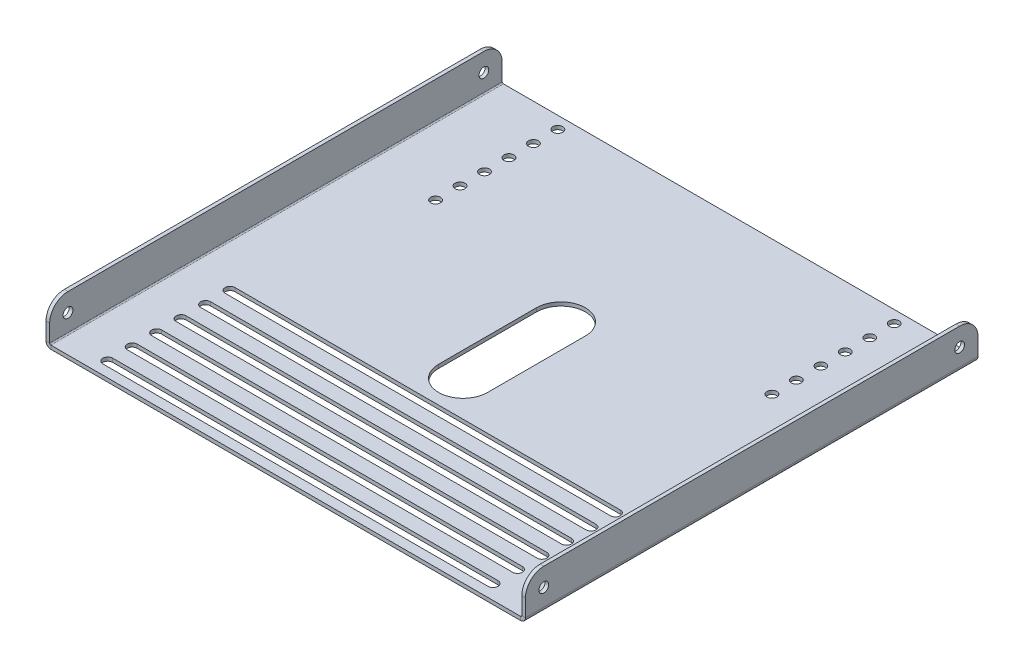
from build123d import *

# Parameters (mm, degrees)
SKETCH1_W                      = 392
SKETCH1_H                      = 370
BASE_FLANGE1_DEPTH             = 3
EDGE_FLANGE1_STRIP_W           = 14
EDGE_FLANGE1_STRIP_H           = 3
EDGE_FLANGE1_STRIP_CUT_DEPTH   = 370
EDGE_FLANGE1_STRIP_2_W         = 14
EDGE_FLANGE1_STRIP_2_H         = 3
EDGE_FLANGE1_STRIP_CUT_2_DEPTH = 370
EDGE_FLANGE1_DEPTH             = 370
EDGE_FLANGE1_BEND_DEPTH        = 370
CUT_EXTRUDE1_REACH             = 436.499
SKETCH11_R                     = 4
CUT_EXTRUDE2_REACH             = 273.533
SKETCH12_R                     = 4
CUT_EXTRUDE3_REACH             = 436.499


# Sheet-metal steps are written as plain solids
with BuildPart() as part:
    # Sketch1 → Base-Flange1 (new body)
    with BuildSketch(Plane(origin=(0, 0, 0), x_dir=(1, 0, 0), z_dir=(0, 1, 0))):
        Rectangle(SKETCH1_W, SKETCH1_H)
    extrude(amount=-BASE_FLANGE1_DEPTH)

    # Edge-Flange1 strip (across the edge) → Edge-Flange1 strip cut (cut)
    with BuildSketch(Plane(origin=(-196, 0, -185), x_dir=(1, 0, 0), z_dir=(0, 0, 1))):
        with Locations((-3, -1.5)):
            Rectangle(EDGE_FLANGE1_STRIP_W, EDGE_FLANGE1_STRIP_H)
    extrude(amount=EDGE_FLANGE1_STRIP_CUT_DEPTH, mode=Mode.SUBTRACT)

    # Edge-Flange1 strip 2 (across the edge) → Edge-Flange1 strip cut 2 (cut)
    with BuildSketch(Plane(origin=(196, 0, 185), x_dir=(-1, 0, 0), z_dir=(0, 0, -1))):
        with Locations((-3, -1.5)):
            Rectangle(EDGE_FLANGE1_STRIP_2_W, EDGE_FLANGE1_STRIP_2_H)
    extrude(amount=EDGE_FLANGE1_STRIP_CUT_2_DEPTH, mode=Mode.SUBTRACT)

    # Edge-Flange1 section (across the edge) → Edge-Flange1 (add)
    with BuildSketch(Plane(origin=(-196, 0, -185), x_dir=(1, 0, 0), z_dir=(0, 0, 1))):
        with BuildLine():
            Line((0, 1), (0, 30))
            Line((0, 30), (3, 30))
            Line((3, 30), (3, 1))
            ThreePointArc((3, 1), (3.292893219, 0.292893219), (4, 0))
            Line((4, 0), (4, -3))
            ThreePointArc((4, -3), (1.171572875, -1.828427125), (0, 1))
        make_face()
    extrude(amount=EDGE_FLANGE1_DEPTH)

    # Edge-Flange1 section 2 (across the edge) → Edge-Flange1 bend (add)
    with BuildSketch(Plane(origin=(196, 0, 185), x_dir=(-1, 0, 0), z_dir=(0, 0, -1))):
        with BuildLine():
            Line((0, 1), (0, 30))
            Line((0, 30), (3, 30))
            Line((3, 30), (3, 1))
            ThreePointArc((3, 1), (3.292893219, 0.292893219), (4, 0))
            Line((4, 0), (4, -3))
            ThreePointArc((4, -3), (1.171572875, -1.828427125), (0, 1))
        make_face()
    extrude(amount=EDGE_FLANGE1_BEND_DEPTH)

    # Cut-Extrude1: up to this face of the body (flat: up to its plane)
    cut_extrude1_end = Plane(part.part.faces().sort_by_distance((-196, 15.5, 0))[0])
    # Sketch11 → Cut-Extrude1 (cut, up to the picked face)
    with BuildSketch(Plane(origin=(196, 0, 0), x_dir=(0, 0, -1), z_dir=(1, 0, 0)), mode=Mode.PRIVATE) as cut_extrude1_sk1:
        with Locations(Location((-170, 15, 0), (0, 0, 90))):
            Circle(SKETCH11_R)
    cut_extrude1_tool1 = split(extrude(cut_extrude1_sk1.sketch, amount=-CUT_EXTRUDE1_REACH, mode=Mode.PRIVATE), bisect_by=cut_extrude1_end, keep=Keep.BOTH, mode=Mode.PRIVATE)
    # Sketch11 → Cut-Extrude1 (cut, up to the picked face)
    with BuildSketch(Plane(origin=(196, 0, 0), x_dir=(0, 0, -1), z_dir=(1, 0, 0)), mode=Mode.PRIVATE) as cut_extrude1_sk2:
        with Locations(Location((170, 15, 0), (0, 0, 90))):
            Circle(SKETCH11_R)
    cut_extrude1_tool2 = split(extrude(cut_extrude1_sk2.sketch, amount=-CUT_EXTRUDE1_REACH, mode=Mode.PRIVATE), bisect_by=cut_extrude1_end, keep=Keep.BOTH, mode=Mode.PRIVATE)
    add(cut_extrude1_tool1.solids().sort_by(Axis((196, 15, 170), (-1, 0, 0)))[0], mode=Mode.SUBTRACT)
    add(cut_extrude1_tool2.solids().sort_by(Axis((196, 15, -170), (-1, 0, 0)))[0], mode=Mode.SUBTRACT)

    # Sketch12 → Cut-Extrude2 (cut, up to next)
    with BuildSketch(Plane.XZ.offset(3), mode=Mode.PRIVATE) as cut_extrude2_sk1:
        with Locations(Location((-137.5, -135, 0), (0, 0, 270))):
            Circle(SKETCH12_R)
    cut_extrude2_tool1 = extrude(cut_extrude2_sk1.sketch, amount=-CUT_EXTRUDE2_REACH, mode=Mode.PRIVATE) & part.part
    # Sketch12 → Cut-Extrude2 (cut, up to next)
    with BuildSketch(Plane.XZ.offset(3), mode=Mode.PRIVATE) as cut_extrude2_sk2:
        with Locations(Location((137.5, -135, 0), (0, 0, 90))):
            Circle(SKETCH12_R)
    cut_extrude2_tool2 = extrude(cut_extrude2_sk2.sketch, amount=-CUT_EXTRUDE2_REACH, mode=Mode.PRIVATE) & part.part
    # Sketch12 → Cut-Extrude2 (cut, up to next)
    with BuildSketch(Plane.XZ.offset(3), mode=Mode.PRIVATE) as cut_extrude2_sk3:
        with Locations(Location((-137.5, -115, 0), (0, 0, 270))):
            Circle(SKETCH12_R)
    cut_extrude2_tool3 = extrude(cut_extrude2_sk3.sketch, amount=-CUT_EXTRUDE2_REACH, mode=Mode.PRIVATE) & part.part
    # Sketch12 → Cut-Extrude2 (cut, up to next)
    with BuildSketch(Plane.XZ.offset(3), mode=Mode.PRIVATE) as cut_extrude2_sk4:
        with Locations(Location((137.5, -115, 0), (0, 0, 90))):
            Circle(SKETCH12_R)
    cut_extrude2_tool4 = extrude(cut_extrude2_sk4.sketch, amount=-CUT_EXTRUDE2_REACH, mode=Mode.PRIVATE) & part.part
    # Sketch12 → Cut-Extrude2 (cut, up to next)
    with BuildSketch(Plane.XZ.offset(3), mode=Mode.PRIVATE) as cut_extrude2_sk5:
        with Locations(Location((-137.5, -95, 0), (0, 0, 270))):
            Circle(SKETCH12_R)
    cut_extrude2_tool5 = extrude(cut_extrude2_sk5.sketch, amount=-CUT_EXTRUDE2_REACH, mode=Mode.PRIVATE) & part.part
    # Sketch12 → Cut-Extrude2 (cut, up to next)
    with BuildSketch(Plane.XZ.offset(3), mode=Mode.PRIVATE) as cut_extrude2_sk6:
        with Locations(Location((137.5, -95, 0), (0, 0, 90))):
            Circle(SKETCH12_R)
    cut_extrude2_tool6 = extrude(cut_extrude2_sk6.sketch, amount=-CUT_EXTRUDE2_REACH, mode=Mode.PRIVATE) & part.part
    # Sketch12 → Cut-Extrude2 (cut, up to next)
    with BuildSketch(Plane.XZ.offset(3), mode=Mode.PRIVATE) as cut_extrude2_sk7:
        with Locations(Location((-137.5, -75, 0), (0, 0, 270))):
            Circle(SKETCH12_R)
    cut_extrude2_tool7 = extrude(cut_extrude2_sk7.sketch, amount=-CUT_EXTRUDE2_REACH, mode=Mode.PRIVATE) & part.part
    # Sketch12 → Cut-Extrude2 (cut, up to next)
    with BuildSketch(Plane.XZ.offset(3), mode=Mode.PRIVATE) as cut_extrude2_sk8:
        with Locations(Location((137.5, -75, 0), (0, 0, 90))):
            Circle(SKETCH12_R)
    cut_extrude2_tool8 = extrude(cut_extrude2_sk8.sketch, amount=-CUT_EXTRUDE2_REACH, mode=Mode.PRIVATE) & part.part
    # Sketch12 → Cut-Extrude2 (cut, up to next)
    with BuildSketch(Plane.XZ.offset(3), mode=Mode.PRIVATE) as cut_extrude2_sk9:
        with Locations(Location((-137.5, -155, 0), (0, 0, 270))):
            Circle(SKETCH12_R)
    cut_extrude2_tool9 = extrude(cut_extrude2_sk9.sketch, amount=-CUT_EXTRUDE2_REACH, mode=Mode.PRIVATE) & part.part
    # Sketch12 → Cut-Extrude2 (cut, up to next)
    with BuildSketch(Plane.XZ.offset(3), mode=Mode.PRIVATE) as cut_extrude2_sk10:
        with Locations(Location((137.5, -155, 0), (0, 0, 90))):
            Circle(SKETCH12_R)
    cut_extrude2_tool10 = extrude(cut_extrude2_sk10.sketch, amount=-CUT_EXTRUDE2_REACH, mode=Mode.PRIVATE) & part.part
    # Sketch12 → Cut-Extrude2 (cut, up to next)
    with BuildSketch(Plane.XZ.offset(3), mode=Mode.PRIVATE) as cut_extrude2_sk11:
        with Locations(Location((-137.5, -175, 0), (0, 0, 270))):
            Circle(SKETCH12_R)
    cut_extrude2_tool11 = extrude(cut_extrude2_sk11.sketch, amount=-CUT_EXTRUDE2_REACH, mode=Mode.PRIVATE) & part.part
    # Sketch12 → Cut-Extrude2 (cut, up to next)
    with BuildSketch(Plane.XZ.offset(3), mode=Mode.PRIVATE) as cut_extrude2_sk12:
        with Locations(Location((137.5, -175, 0), (0, 0, 90))):
            Circle(SKETCH12_R)
    cut_extrude2_tool12 = extrude(cut_extrude2_sk12.sketch, amount=-CUT_EXTRUDE2_REACH, mode=Mode.PRIVATE) & part.part
    # Sketch12 → Cut-Extrude2 (cut, up to next)
    with BuildSketch(Plane.XZ.offset(3), mode=Mode.PRIVATE) as cut_extrude2_sk13:
        with BuildLine():
            Line((157.5, 108.95), (-157.5, 108.95))
            ThreePointArc((-157.5, 108.95), (-161.55, 113), (-157.5, 117.05))
            Line((-157.5, 117.05), (157.5, 117.05))
            ThreePointArc((157.5, 117.05), (161.55, 113), (157.5, 108.95))
        make_face()
    cut_extrude2_tool13 = extrude(cut_extrude2_sk13.sketch, amount=-CUT_EXTRUDE2_REACH, mode=Mode.PRIVATE) & part.part
    # Sketch12 → Cut-Extrude2 (cut, up to next)
    with BuildSketch(Plane.XZ.offset(3), mode=Mode.PRIVATE) as cut_extrude2_sk14:
        with BuildLine():
            Line((157.5, 128.95), (-157.5, 128.95))
            ThreePointArc((-157.5, 128.95), (-161.55, 133), (-157.5, 137.05))
            Line((-157.5, 137.05), (157.5, 137.05))
            ThreePointArc((157.5, 137.05), (161.55, 133), (157.5, 128.95))
        make_face()
    cut_extrude2_tool14 = extrude(cut_extrude2_sk14.sketch, amount=-CUT_EXTRUDE2_REACH, mode=Mode.PRIVATE) & part.part
    # Sketch12 → Cut-Extrude2 (cut, up to next)
    with BuildSketch(Plane.XZ.offset(3), mode=Mode.PRIVATE) as cut_extrude2_sk15:
        with BuildLine():
            Line((157.5, 148.95), (-157.5, 148.95))
            ThreePointArc((-157.5, 148.95), (-161.55, 153), (-157.5, 157.05))
            Line((-157.5, 157.05), (157.5, 157.05))
            ThreePointArc((157.5, 157.05), (161.55, 153), (157.5, 148.95))
        make_face()
    cut_extrude2_tool15 = extrude(cut_extrude2_sk15.sketch, amount=-CUT_EXTRUDE2_REACH, mode=Mode.PRIVATE) & part.part
    # Sketch12 → Cut-Extrude2 (cut, up to next)
    with BuildSketch(Plane.XZ.offset(3), mode=Mode.PRIVATE) as cut_extrude2_sk16:
        with BuildLine():
            Line((157.5, 168.95), (-157.5, 168.95))
            ThreePointArc((-157.5, 168.95), (-161.55, 173), (-157.5, 177.05))
            Line((-157.5, 177.05), (157.5, 177.05))
            ThreePointArc((157.5, 177.05), (161.55, 173), (157.5, 168.95))
        make_face()
    cut_extrude2_tool16 = extrude(cut_extrude2_sk16.sketch, amount=-CUT_EXTRUDE2_REACH, mode=Mode.PRIVATE) & part.part
    # Sketch12 → Cut-Extrude2 (cut, up to next)
    with BuildSketch(Plane.XZ.offset(3), mode=Mode.PRIVATE) as cut_extrude2_sk17:
        with BuildLine():
            Line((20, 40), (20, -40))
            ThreePointArc((20, -40), (0, -60), (-20, -40))
            Line((-20, -40), (-20, 40))
            ThreePointArc((-20, 40), (0, 60), (20, 40))
        make_face()
    cut_extrude2_tool17 = extrude(cut_extrude2_sk17.sketch, amount=-CUT_EXTRUDE2_REACH, mode=Mode.PRIVATE) & part.part
    # Sketch12 → Cut-Extrude2 (cut, up to next)
    with BuildSketch(Plane.XZ.offset(3), mode=Mode.PRIVATE) as cut_extrude2_sk18:
        with BuildLine():
            Line((157.5, 88.95), (-157.5, 88.95))
            ThreePointArc((-157.5, 88.95), (-161.55, 93), (-157.5, 97.05))
            Line((-157.5, 97.05), (157.5, 97.05))
            ThreePointArc((157.5, 97.05), (161.55, 93), (157.5, 88.95))
        make_face()
    cut_extrude2_tool18 = extrude(cut_extrude2_sk18.sketch, amount=-CUT_EXTRUDE2_REACH, mode=Mode.PRIVATE) & part.part
    # Sketch12 → Cut-Extrude2 (cut, up to next)
    with BuildSketch(Plane.XZ.offset(3), mode=Mode.PRIVATE) as cut_extrude2_sk19:
        with BuildLine():
            Line((157.5, 68.95), (-157.5, 68.95))
            ThreePointArc((-157.5, 68.95), (-161.55, 73), (-157.5, 77.05))
            Line((-157.5, 77.05), (157.5, 77.05))
            ThreePointArc((157.5, 77.05), (161.55, 73), (157.5, 68.95))
        make_face()
    cut_extrude2_tool19 = extrude(cut_extrude2_sk19.sketch, amount=-CUT_EXTRUDE2_REACH, mode=Mode.PRIVATE) & part.part
    add(cut_extrude2_tool1.solids().sort_by_distance((-137.5, -3, -135))[0], mode=Mode.SUBTRACT)
    add(cut_extrude2_tool2.solids().sort_by_distance((137.5, -3, -135))[0], mode=Mode.SUBTRACT)
    add(cut_extrude2_tool3.solids().sort_by_distance((-137.5, -3, -115))[0], mode=Mode.SUBTRACT)
    add(cut_extrude2_tool4.solids().sort_by_distance((137.5, -3, -115))[0], mode=Mode.SUBTRACT)
    add(cut_extrude2_tool5.solids().sort_by_distance((-137.5, -3, -95))[0], mode=Mode.SUBTRACT)
    add(cut_extrude2_tool6.solids().sort_by_distance((137.5, -3, -95))[0], mode=Mode.SUBTRACT)
    add(cut_extrude2_tool7.solids().sort_by_distance((-137.5, -3, -75))[0], mode=Mode.SUBTRACT)
    add(cut_extrude2_tool8.solids().sort_by_distance((137.5, -3, -75))[0], mode=Mode.SUBTRACT)
    add(cut_extrude2_tool9.solids().sort_by_distance((-137.5, -3, -155))[0], mode=Mode.SUBTRACT)
    add(cut_extrude2_tool10.solids().sort_by_distance((137.5, -3, -155))[0], mode=Mode.SUBTRACT)
    add(cut_extrude2_tool11.solids().sort_by_distance((-137.5, -3, -175))[0], mode=Mode.SUBTRACT)
    add(cut_extrude2_tool12.solids().sort_by_distance((137.5, -3, -175))[0], mode=Mode.SUBTRACT)
    add(cut_extrude2_tool13.solids().sort_by_distance((0, -3, 113))[0], mode=Mode.SUBTRACT)
    add(cut_extrude2_tool14.solids().sort_by_distance((0, -3, 133))[0], mode=Mode.SUBTRACT)
    add(cut_extrude2_tool15.solids().sort_by_distance((0, -3, 153))[0], mode=Mode.SUBTRACT)
    add(cut_extrude2_tool16.solids().sort_by_distance((0, -3, 173))[0], mode=Mode.SUBTRACT)
    add(cut_extrude2_tool17.solids().sort_by_distance((0, -3, 0))[0], mode=Mode.SUBTRACT)
    add(cut_extrude2_tool18.solids().sort_by_distance((0, -3, 93))[0], mode=Mode.SUBTRACT)
    add(cut_extrude2_tool19.solids().sort_by_distance((0, -3, 73))[0], mode=Mode.SUBTRACT)

    # Cut-Extrude3: up to this face of the body (flat: up to its plane)
    cut_extrude3_end = Plane(part.part.faces().sort_by_distance((-196, 15.50472888, 0))[0])
    # Sketch13 → Cut-Extrude3 (cut, up to the picked face)
    with BuildSketch(Plane(origin=(196, 0, 0), x_dir=(0, 0, -1), z_dir=(1, 0, 0)), mode=Mode.PRIVATE) as cut_extrude3_sk1:
        with BuildLine():
            Line((185, 30), (170, 30))
            ThreePointArc((170, 30), (180.606601718, 25.606601718), (185, 15))
            Line((185, 15), (185, 30))
        make_face()
    cut_extrude3_tool1 = split(extrude(cut_extrude3_sk1.sketch, amount=-CUT_EXTRUDE3_REACH, mode=Mode.PRIVATE), bisect_by=cut_extrude3_end, keep=Keep.BOTH, mode=Mode.PRIVATE)
    # Sketch13 → Cut-Extrude3 (cut, up to the picked face)
    with BuildSketch(Plane(origin=(196, 0, 0), x_dir=(0, 0, -1), z_dir=(1, 0, 0)), mode=Mode.PRIVATE) as cut_extrude3_sk2:
        with BuildLine():
            Line((-185, 30), (-185, 15))
            ThreePointArc((-185, 15), (-180.606601718, 25.606601718), (-170, 30))
            Line((-170, 30), (-185, 30))
        make_face()
    cut_extrude3_tool2 = split(extrude(cut_extrude3_sk2.sketch, amount=-CUT_EXTRUDE3_REACH, mode=Mode.PRIVATE), bisect_by=cut_extrude3_end, keep=Keep.BOTH, mode=Mode.PRIVATE)
    add(cut_extrude3_tool1.solids().sort_by(Axis((196, 26.649481, -181.649481), (-1, 0, 0)))[0], mode=Mode.SUBTRACT)
    add(cut_extrude3_tool2.solids().sort_by(Axis((196, 26.649481, 181.649481), (-1, 0, 0)))[0], mode=Mode.SUBTRACT)


solid = part.part
